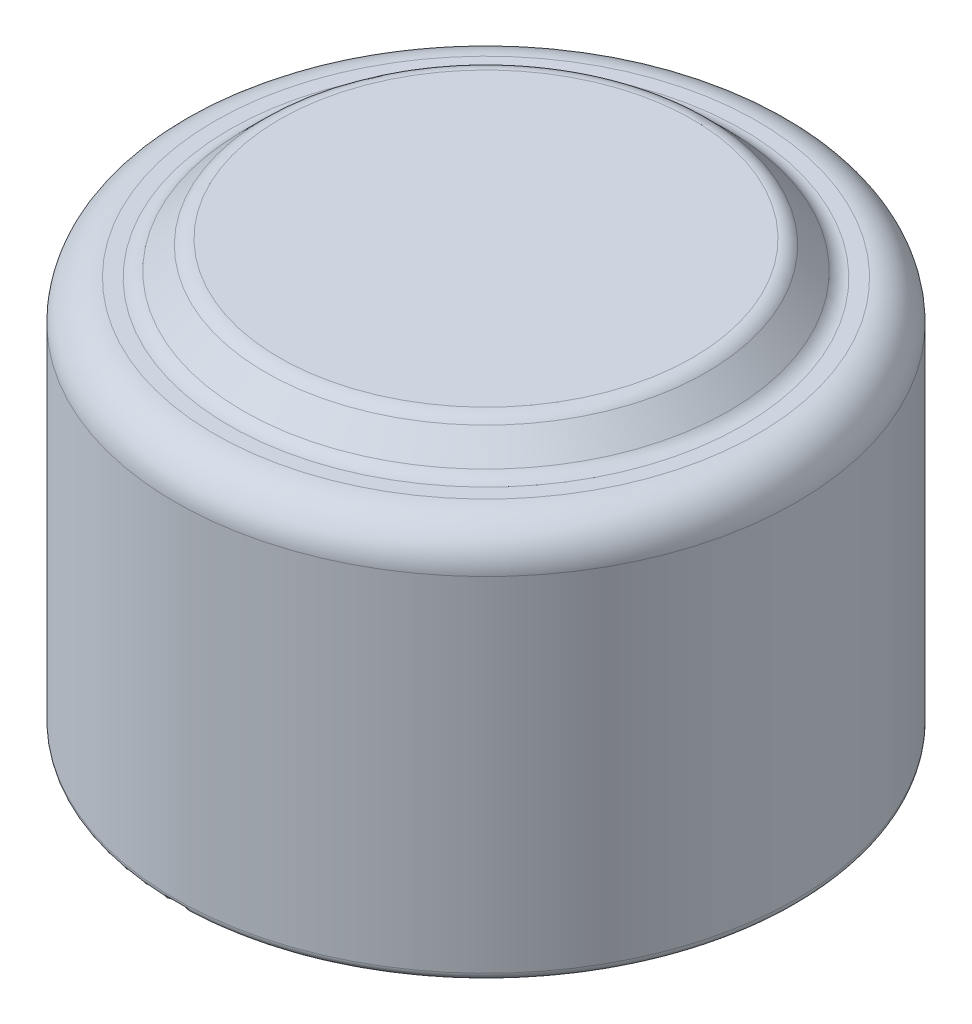
from build123d import *


with BuildPart() as part:
    # Sketch1 → Revolve1 (revolve)
    with BuildSketch(Plane.XY):
        with BuildLine():
            Line((0, 0), (-3.85, 0))
            ThreePointArc((-3.85, 0), (-3.920710678, 0.029289322), (-3.95, 0.1))
            Line((-3.95, 0.1), (-3.95, 4.47))
            ThreePointArc((-3.95, 4.47), (-3.803553391, 4.823553391), (-3.45, 4.97))
            Line((-3.45, 4.97), (-3.263553391, 4.97))
            ThreePointArc((-3.263553391, 4.97), (-3.167882533, 4.989030117), (-3.086776695, 5.043223305))
            Line((-3.086776695, 5.043223305), (-2.803223305, 5.326776695))
            ThreePointArc((-2.803223305, 5.326776695), (-2.722117467, 5.380969883), (-2.626446609, 5.4))
            Line((-2.626446609, 5.4), (0, 5.4))
            Line((0, 5.4), (0, 0))
        make_face()
    revolve(axis=Axis((0, 5.4, 0), (0, -1, 0)))


solid = part.part
